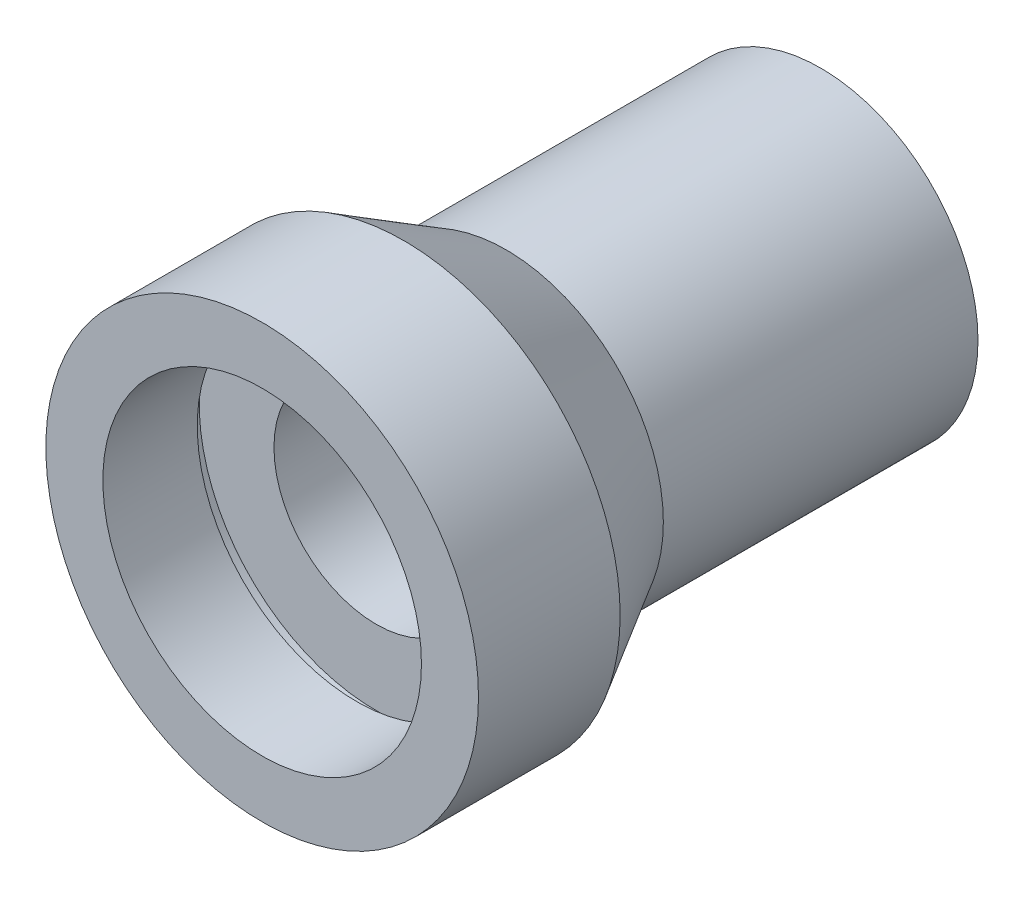
from build123d import *

# Parameters (mm, degrees)
BOSS_EXTRUDE1_DEPTH      = 1
BOSS_EXTRUDE1_DEPTH_BACK = 10
SKETCH1_R                = 4
SKETCH1_R_2              = 2.6
SKETCH2_R                = 5.5
BOSS_EXTRUDE2_DEPTH      = 3.2
SKETCH3_R                = 4.05
CUT_EXTRUDE1_DEPTH       = 2.9
SKETCH4_R                = 2.6
CUT_EXTRUDE2_DEPTH       = 17.190738093
SKETCH5_R                = 4.5
CUT_EXTRUDE3_DEPTH       = 0.5
CHAMFER1_SIZE            = 1.732050808
CHAMFER1_SIZE_2          = 3


with BuildPart() as part:
    # Sketch1 → Boss-Extrude1 (new, two sides: drawn at the far end of the back side and taken through both)
    with BuildSketch(Plane.XY.offset(-BOSS_EXTRUDE1_DEPTH_BACK)):
        Circle(SKETCH1_R)
        Circle(SKETCH1_R_2, mode=Mode.SUBTRACT)
    extrude(amount=BOSS_EXTRUDE1_DEPTH + BOSS_EXTRUDE1_DEPTH_BACK)

    # Sketch2 → Boss-Extrude2 (add)
    with BuildSketch(Plane.XY.offset(1)):
        Circle(SKETCH2_R)
    extrude(amount=BOSS_EXTRUDE2_DEPTH)

    # Sketch3 → Cut-Extrude1 (cut)
    with BuildSketch(Plane.XY.offset(4.2)):
        Circle(SKETCH3_R)
    extrude(amount=-CUT_EXTRUDE1_DEPTH, mode=Mode.SUBTRACT)

    # Sketch4 → Cut-Extrude2 (cut, through all)
    with BuildSketch(Plane(origin=(0, 0, -10), x_dir=(-1, 0, 0), z_dir=(0, 0, -1))):
        with Locations(Location((0, 0, 0), (0, 0, 180))):
            Circle(SKETCH4_R)
    extrude(amount=-CUT_EXTRUDE2_DEPTH, mode=Mode.SUBTRACT)

    # Sketch5 → Cut-Extrude3 (cut)
    with BuildSketch(Plane.XY.offset(1.3)):
        Circle(SKETCH5_R)
    extrude(amount=CUT_EXTRUDE3_DEPTH, mode=Mode.SUBTRACT)

    # Chamfer1
    # the kernel refuses this chamfer: 3, 1.732050808 mm, written as the material it adds along each edge
    with BuildSketch(Plane(origin=(0, 0, 1), x_dir=(1, 0, 0), z_dir=(0, -1, 0))) as chamfer1_piece_1_section:
        Polygon((4 + CHAMFER1_SIZE, 0), (4, -CHAMFER1_SIZE_2), (4, 0), align=None)
    chamfer1_piece_1 = revolve(axis=Axis((0, 0, 1), (0, 0, 1)), mode=Mode.PRIVATE)
    chamfer1_piece_1 = chamfer1_piece_1 & Plane(origin=(0, 0, -0.731250221), x_dir=(1, 0, 0), z_dir=(0, 0, -1)) * Cylinder(5.5, 23, mode=Mode.PRIVATE)
    add(chamfer1_piece_1)


solid = part.part
